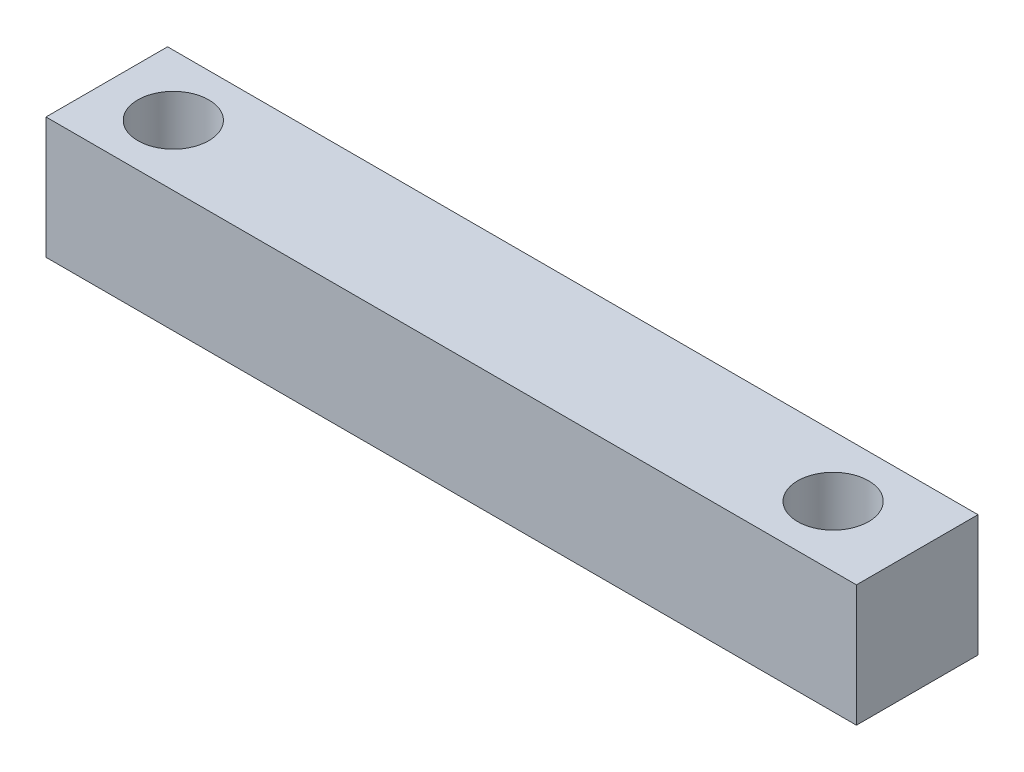
from build123d import *

# Parameters (mm, degrees)
BOSS_EXTRUDE1_OUTLINE_W = 40
BOSS_EXTRUDE1_OUTLINE_H = 6
BOSS_EXTRUDE1_DEPTH     = 10
SKETCH3_R               = 1.75
CUT_EXTRUDE1_DEPTH      = 42.665333312
MOVE_FACE1_BY           = 4


# Read off the part's stored shape, not the designer's step: Boss-Extrude1
with BuildPart() as part:
    # Boss-Extrude1 outline → Boss-Extrude1 (new body)
    with BuildSketch(Plane(origin=(0, 0, 0), x_dir=(1, 0, 0), z_dir=(0, 1, 0))):
        with Locations((20, 3)):
            Rectangle(BOSS_EXTRUDE1_OUTLINE_W, BOSS_EXTRUDE1_OUTLINE_H)
    extrude(amount=BOSS_EXTRUDE1_DEPTH)

    # Sketch3 → Cut-Extrude1 (cut, through all)
    with BuildSketch(Plane(origin=(0, 10, 0), x_dir=(1, 0, 0), z_dir=(0, 1, 0))):
        with Locations(Location((35.85, 3, 0), (0, 0, 270))):
            Circle(SKETCH3_R)
        with Locations(Location((3.28320942, 3, 0), (0, 0, 270))):
            Circle(SKETCH3_R)
    extrude(amount=-CUT_EXTRUDE1_DEPTH, mode=Mode.SUBTRACT)

    # Move Face1: a face moved inward by 4.0
    extrude(part.faces().sort_by_distance((20.037776716, 10, -3))[0], amount=MOVE_FACE1_BY, dir=(0, -1, 0), mode=Mode.SUBTRACT)


solid = part.part
